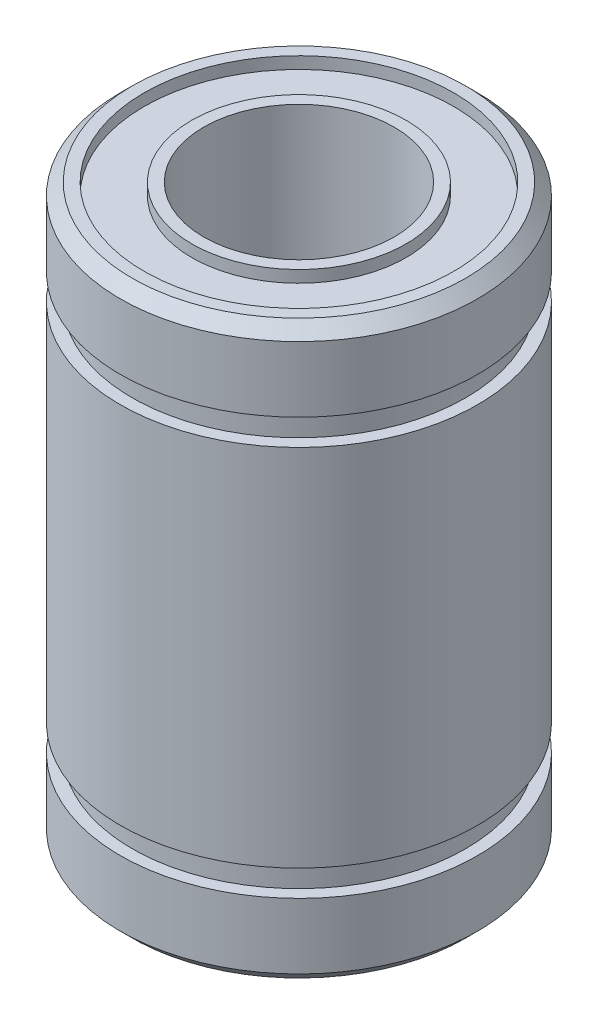
from build123d import *

# Parameters (mm, degrees)
SKETCH2_R          = 6.5
SKETCH2_R_2        = 4.5
CUT_EXTRUDE1_DEPTH = 0.5


with BuildPart() as part:
    # Sketch1 → Revolve1 (revolve)
    with BuildSketch(Plane.XY):
        Polygon((4, -12), (4, 12), (7, 12), (7.5, 11.5), (7.5, 8.75), (7, 8.75), (7, 7.65), (7.5, 7.65), (7.5, -7.65), (7, -7.65), (7, -8.75), (7.5, -8.75), (7.5, -11.5), (7, -12), align=None)
    revolve(axis=Axis((0, 12, 0), (0, -1, 0)))

    # Sketch2 → Cut-Extrude1 (cut)
    with BuildSketch(Plane(origin=(0, 12, 0), x_dir=(1, 0, 0), z_dir=(0, 1, 0))):
        Circle(SKETCH2_R)
        Circle(SKETCH2_R_2, mode=Mode.SUBTRACT)
    cut_extrude1 = extrude(amount=-CUT_EXTRUDE1_DEPTH, mode=Mode.SUBTRACT)

    # Mirror1: Cut-Extrude1 across plane
    add(cut_extrude1.mirror(Plane.ZX), mode=Mode.SUBTRACT)


solid = part.part
